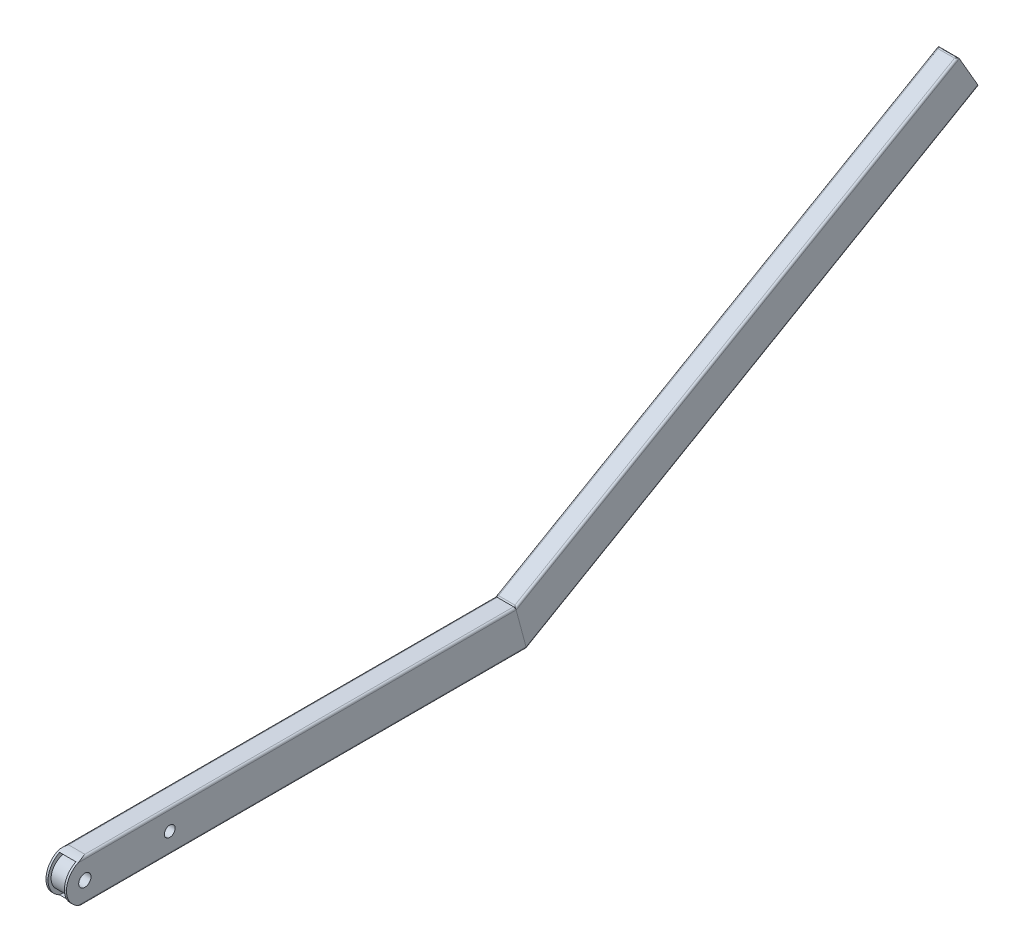
from build123d import *

# Parameters (mm, degrees)
SCHIZZO1_W                    = 16
SCHIZZO1_H                    = 36
ESTRUSIONE_SOTTILE1_DEPTH     = 450
SCHIZZO2_R                    = 15
ESTRUSIONE_ESTRUSIONE1_DEPTH  = 16
RIPETIZIONE_A_L1_COUNT        = 2
RIPETIZIONE_A_L1_PITCH        = 83
SCHIZZO3_R                    = 6
SCHIZZO3_R_2                  = 5.25
TAGLIO_ESTRUSIONE1_DEPTH      = 453.216762184
TAGLIO_ESTRUSIONE2_DEPTH      = 453.216762184
RACCORDO1_R                   = 20
ESTRUSIONE_ESTRUSIONE2_DEPTH  = 10
RACCORDO2_R                   = 2
TAGLIO_ESTRUSIONE3_DEPTH      = 929.330815786
TAGLIO_ESTRUSIONE3_DEPTH_BACK = 929.330815786
SCHIZZO7_W                    = 16
SCHIZZO7_H                    = 36


with BuildPart() as part:
    # Schizzo1 → Estrusione-Sottile1 (new body)
    with BuildSketch(Plane.XY):
        with BuildLine():
            Line((0, 38), (0, 2))
            ThreePointArc((0, 2), (0.585786438, 0.585786438), (2, 0))
            Line((2, 0), (18, 0))
            ThreePointArc((18, 0), (19.414213562, 0.585786438), (20, 2))
            Line((20, 2), (20, 38))
            ThreePointArc((20, 38), (19.414213562, 39.414213562), (18, 40))
            Line((18, 40), (2, 40))
            ThreePointArc((2, 40), (0.585786438, 39.414213562), (0, 38))
        make_face()
        with Locations((10, 20)):
            Rectangle(SCHIZZO1_W, SCHIZZO1_H, mode=Mode.SUBTRACT)
    extrude(amount=ESTRUSIONE_SOTTILE1_DEPTH)

    # Schizzo2 → Estrusione-Estrusione1 (add)
    with BuildSketch(Plane(origin=(2, 0, 0), x_dir=(0, 0, -1), z_dir=(1, 0, 0))):
        with Locations(Location((-432, 20, 0), (0, 0, 180))):
            Circle(SCHIZZO2_R)
    estrusione_estrusione1 = extrude(amount=ESTRUSIONE_ESTRUSIONE1_DEPTH)

    # Ripetizione a L1: Estrusione-Estrusione1 ×2
    with Locations(*[(0, 0, -i * RIPETIZIONE_A_L1_PITCH) for i in range(1, RIPETIZIONE_A_L1_COUNT)]):
        add(estrusione_estrusione1)

    # Schizzo3 → Taglio-Estrusione1 (cut, through all)
    with BuildSketch(Plane(origin=(20, 0, 0), x_dir=(0, 0, -1), z_dir=(1, 0, 0))):
        with Locations((-432, 20)):
            Circle(SCHIZZO3_R)
        with Locations((-349, 20)):
            Circle(SCHIZZO3_R_2)
    extrude(amount=-TAGLIO_ESTRUSIONE1_DEPTH, mode=Mode.SUBTRACT)

    # Schizzo4 → Taglio-Estrusione2 (cut, through all)
    with BuildSketch(Plane(origin=(20, 0, 0), x_dir=(0, 0, -1), z_dir=(1, 0, 0))):
        Polygon((0, 0), (-10.717967697, 40), (0, 40), align=None)
    extrude(amount=-TAGLIO_ESTRUSIONE2_DEPTH, mode=Mode.SUBTRACT)

    # Raccordo1
    # the kernel refuses this fillet: 20 mm, written as the material it takes off along each edge
    with BuildSketch(Plane(origin=(-48, 0, 450), x_dir=(0, 1, 0), z_dir=(1, 0, 0)), Plane(origin=(68, 40, 450), x_dir=(0, -1, 0), z_dir=(-1, 0, 0))) as raccordo1_piece_1:
        with BuildLine():
            CenterArc((RACCORDO1_R, -RACCORDO1_R), RACCORDO1_R, 90, 90)
            Line((0, -RACCORDO1_R), (0, 0))
            Line((0, 0), (RACCORDO1_R, 0))
        make_face()
    extrude(amount=116, mode=Mode.SUBTRACT)


with BuildPart() as body_2:
    # Schizzo5 → Estrusione-Estrusione2 (new, symmetric)
    with BuildSketch(Plane(origin=(10, 0, 0), x_dir=(0, 0, -1), z_dir=(1, 0, 0))):
        Polygon((422.294734195, 290), (442.294734195, 255.358983849), (0, 0), (-10.717967697, 40), align=None)
    extrude(amount=ESTRUSIONE_ESTRUSIONE2_DEPTH, both=True)

    # Raccordo2
    raccordo2_edges = [body_2.edges().sort_by_distance(p)[0] for p in [
        (20, 165, -205.788383249),
        (20, 127.679491924, -221.147367097),
        (0, 165, -205.788383249),
        (0, 127.679491924, -221.147367097),
        (10, 40, 10.717967697),
        (10, 290, -422.294734195),
    ]]
    fillet(raccordo2_edges, radius=RACCORDO2_R)

    # Schizzo7 → Taglio-Estrusione3 (cut, two sides: drawn at the far end of the back side and taken through both)
    with BuildSketch(Plane(origin=(0, 255.358983849, -442.294734195), x_dir=(-1, 0, 0), z_dir=(0, 0.4999999999999891, -0.8660254037844448)).offset(-TAGLIO_ESTRUSIONE3_DEPTH_BACK)):
        with Locations((-10, 20)):
            Rectangle(SCHIZZO7_W, SCHIZZO7_H)
    extrude(amount=TAGLIO_ESTRUSIONE3_DEPTH + TAGLIO_ESTRUSIONE3_DEPTH_BACK, mode=Mode.SUBTRACT)


solid = Compound([part.part, body_2.part])
